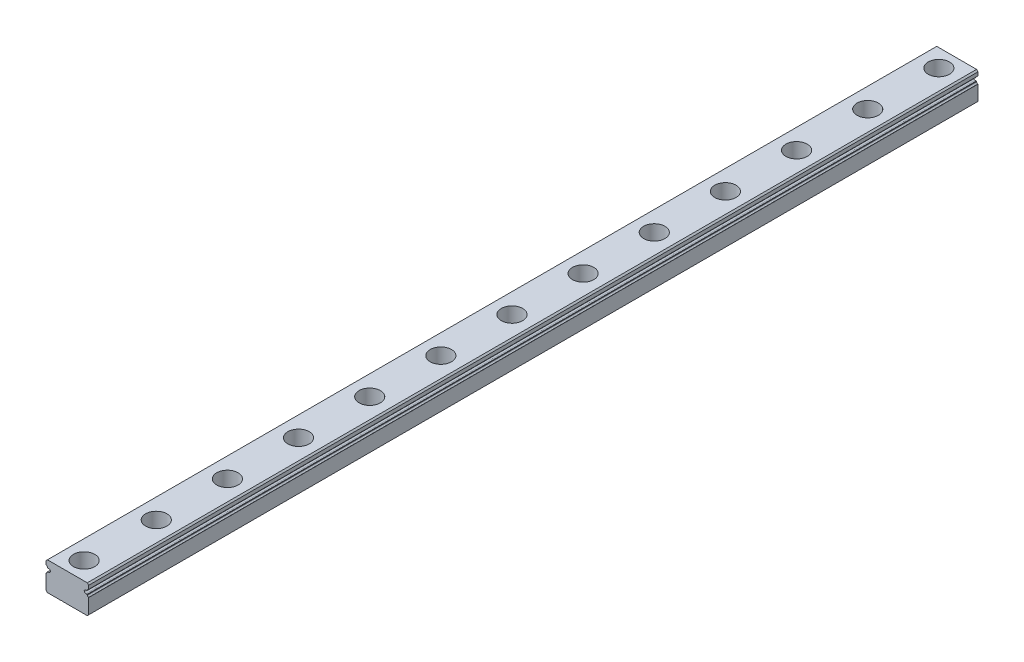
from build123d import *

# Parameters (mm, degrees)
CROQUIS1_W                                           = 12
CROQUIS1_H                                           = 250
SALIENTE_EXTRUIR1_DEPTH                              = 8
CORTAR_EXTRUIR1_DEPTH                                = 251.104793708
CORTAR_EXTRUIR2_DEPTH                                = 251.104793708
CORTAR_EXTRUIR3_DEPTH                                = 251.104793708
CORTAR_EXTRUIR4_DEPTH                                = 251.104793708
CORTAR_EXTRUIR5_DEPTH                                = 251.104793708
CORTAR_EXTRUIR6_DEPTH                                = 251.104793708
CORTAR_EXTRUIR7_DEPTH                                = 251.104793708
REFRENTADO_PARA_TORNILLO_CON_CABEZA_HEXA_D           = 3.5
REFRENTADO_PARA_TORNILLO_CON_CABEZA_HEXA_CBORE_D     = 6
REFRENTADO_PARA_TORNILLO_CON_CABEZA_HEXA_CBORE_DEPTH = 4.5
CHAFL_N1_SIZE                                        = 0.4
CHAFL_N2_SIZE                                        = 0.034056407
CHAFL_N2_SIZE_2                                      = 0.03688403
CHAFL_N3_SIZE                                        = 0.091173812
CHAFL_N3_SIZE_2                                      = 0.105000846


with BuildPart() as part:
    # Croquis1 → Saliente-Extruir1 (new body)
    with BuildSketch(Plane(origin=(0, 4.050658692, 0), x_dir=(1, 0, 0), z_dir=(0, 1, 0))):
        with Locations((0, 125)):
            Rectangle(CROQUIS1_W, CROQUIS1_H)
    extrude(amount=-SALIENTE_EXTRUIR1_DEPTH)

    # Croquis2 → Cortar-Extruir1 (cut, through all)
    with BuildSketch(Plane(origin=(0, 0, -250), x_dir=(-1, 0, 0), z_dir=(0, 0, -1))):
        with BuildLine():
            Line((1.35, -3.949341308), (1.85, -3.949341308))
            ThreePointArc((1.85, -3.949341308), (1.6, -3.849341308), (1.35, -3.949341308))
        make_face()
    extrude(amount=-CORTAR_EXTRUIR1_DEPTH, mode=Mode.SUBTRACT)

    # Croquis3 → Cortar-Extruir2 (cut, through all)
    with BuildSketch(Plane(origin=(0, 0, -250), x_dir=(-1, 0, 0), z_dir=(0, 0, -1))):
        with BuildLine():
            Line((-6, 2.100658692), (-6, 1.200658692))
            Line((-6, 1.200658692), (-5.2, 1.200658692))
            ThreePointArc((-5.2, 1.200658692), (-4.75, 1.650658692), (-5.2, 2.100658692))
            Line((-5.2, 2.100658692), (-6, 2.100658692))
        make_face()
    extrude(amount=-CORTAR_EXTRUIR2_DEPTH, mode=Mode.SUBTRACT)

    # Croquis4 → Cortar-Extruir3 (cut, through all)
    with BuildSketch(Plane(origin=(0, 0, -250), x_dir=(-1, 0, 0), z_dir=(0, 0, -1))):
        with BuildLine():
            Line((-5.622557264, 1.200658692), (-6, 1.200658692))
            Line((-6, 1.200658692), (-6, 0.689297919))
            ThreePointArc((-6, 0.689297919), (-5.684900038, 0.851696449), (-5.622557264, 1.200658692))
        make_face()
    extrude(amount=-CORTAR_EXTRUIR3_DEPTH, mode=Mode.SUBTRACT)

    # Croquis5 → Cortar-Extruir4 (cut, through all)
    with BuildSketch(Plane(origin=(0, 0, -250), x_dir=(-1, 0, 0), z_dir=(0, 0, -1))):
        with BuildLine():
            Line((-6, 2.612019466), (-6, 2.100658692))
            Line((-6, 2.100658692), (-5.622557264, 2.100658692))
            ThreePointArc((-5.622557264, 2.100658692), (-5.684900038, 2.449620935), (-6, 2.612019466))
        make_face()
    extrude(amount=-CORTAR_EXTRUIR4_DEPTH, mode=Mode.SUBTRACT)

    # Croquis6 → Cortar-Extruir5 (cut, through all)
    with BuildSketch(Plane(origin=(0, 0, -250), x_dir=(-1, 0, 0), z_dir=(0, 0, -1))):
        with BuildLine():
            Line((6, 1.200658692), (6, 2.100658692))
            Line((6, 2.100658692), (5.2, 2.100658692))
            ThreePointArc((5.2, 2.100658692), (4.75, 1.650658692), (5.2, 1.200658692))
            Line((5.2, 1.200658692), (6, 1.200658692))
        make_face()
    extrude(amount=-CORTAR_EXTRUIR5_DEPTH, mode=Mode.SUBTRACT)

    # Croquis7 → Cortar-Extruir6 (cut, through all)
    with BuildSketch(Plane(origin=(0, 0, -250), x_dir=(-1, 0, 0), z_dir=(0, 0, -1))):
        with BuildLine():
            Line((5.622557264, 2.100658692), (6, 2.100658692))
            Line((6, 2.100658692), (6, 2.612019466))
            ThreePointArc((6, 2.612019466), (5.684900038, 2.449620935), (5.622557264, 2.100658692))
        make_face()
    extrude(amount=-CORTAR_EXTRUIR6_DEPTH, mode=Mode.SUBTRACT)

    # Croquis8 → Cortar-Extruir7 (cut, through all)
    with BuildSketch(Plane(origin=(0, 0, -250), x_dir=(-1, 0, 0), z_dir=(0, 0, -1))):
        with BuildLine():
            Line((6, 0.689297919), (6, 1.200658692))
            Line((6, 1.200658692), (5.622557264, 1.200658692))
            ThreePointArc((5.622557264, 1.200658692), (5.684900038, 0.851696449), (6, 0.689297919))
        make_face()
    extrude(amount=-CORTAR_EXTRUIR7_DEPTH, mode=Mode.SUBTRACT)

    # Refrentado para tornillo con cabeza hexagonal de M31 (through all)
    with Locations(Plane(origin=(0, 4.050658692, 0), x_dir=(1, 0, 0), z_dir=(0, 1, 0))):
        with Locations((0, 45), (0, 65), (0, 85), (0, 105), (0, 125), (0, 145), (0, 165), (0, 185), (0, 205), (0, 225), (0, 245), (0, 25), (-0.275406539, 5)):
            CounterBoreHole(REFRENTADO_PARA_TORNILLO_CON_CABEZA_HEXA_D / 2, REFRENTADO_PARA_TORNILLO_CON_CABEZA_HEXA_CBORE_D / 2, REFRENTADO_PARA_TORNILLO_CON_CABEZA_HEXA_CBORE_DEPTH)

    # Chaflán1
    chafl_n1_edges = [part.edges().sort_by_distance(p)[0] for p in [
        (-6, -3.949341308, -125),
        (6, -3.949341308, -125),
        (-6, 4.050658692, -125),
        (6, 4.050658692, -125),
    ]]
    chamfer(chafl_n1_edges, length=CHAFL_N1_SIZE)

    # Chaflán2
    # the kernel refuses this chamfer: 0.03688403, 0.034056407 mm, written as the material it takes off along each edge
    with BuildSketch(Plane(origin=(6, 0.689297919, -250.100435582), x_dir=(-0.9978479381588691, 0.06557051404475742, 0), z_dir=(0, 0, 1))) as chafl_n2_piece_1:
        with BuildLine():
            Line((0.03902449, 0), (-CHAFL_N2_SIZE * 0.0655705141026, CHAFL_N2_SIZE * 0.997847939043))
            Line((-CHAFL_N2_SIZE * 0.0655705141026, CHAFL_N2_SIZE * 0.997847939043), (0, 0))
            ThreePointArc((0, 0), (0.020082989, 0.000475786), (0.03902449, 0))
        make_face()
    extrude(amount=250.200871164, mode=Mode.SUBTRACT)
    with BuildSketch(Plane(origin=(6, 2.612019466, -250.094971685), x_dir=(0, 1, 0), z_dir=(0, 0, 1))) as chafl_n2_piece_2:
        with BuildLine():
            Line((CHAFL_N2_SIZE_2 * 0.999999990825, 0), (-0.002179894, 0.035512658))
            ThreePointArc((-0.002179894, 0.035512658), (-0.000727719, 0.018309495), (0, 0))
            Line((0, 0), (CHAFL_N2_SIZE_2 * 0.999999990825, 0))
        make_face()
    extrude(amount=250.189943371, mode=Mode.SUBTRACT)
    with BuildSketch(Plane(origin=(-6, 2.612019466, -250.100435582), x_dir=(0, 1, 0), z_dir=(0, 0, 1))) as chafl_n2_piece_3:
        with BuildLine():
            Line((CHAFL_N2_SIZE, 0), (-0.002558856, -0.038940507))
            ThreePointArc((-0.002558856, -0.038940507), (-0.00084209, -0.020070966), (0, 0))
            Line((0, 0), (CHAFL_N2_SIZE, 0))
        make_face()
    extrude(amount=250.200871164, mode=Mode.SUBTRACT)
    with BuildSketch(Plane(origin=(-6, 0.689297919, -250.094971685), x_dir=(0.9981213351064977, 0.061268265890444186, 0), z_dir=(0, 0, 1))) as chafl_n2_piece_4:
        with BuildLine():
            Line((0.0355795, 0), (-CHAFL_N2_SIZE_2 * 0.0612682653277, -CHAFL_N2_SIZE_2 * 0.998121325949))
            Line((-CHAFL_N2_SIZE_2 * 0.0612682653277, -CHAFL_N2_SIZE_2 * 0.998121325949), (0, 0))
            ThreePointArc((0, 0), (0.018319684, -0.000395439), (0.0355795, 0))
        make_face()
    extrude(amount=250.189943371, mode=Mode.SUBTRACT)

    # Chaflán3
    # the kernel refuses this chamfer: 0.105000846, 0.091173812 mm, written as the material it takes off along each edge
    with BuildSketch(Plane(origin=(5.622557264, 1.200658692, -250.318147751), x_dir=(-0.1263625484615496, -0.991984126055605, 0), z_dir=(0, 0, 1)), Plane(origin=(-5.622557264, 2.100658692, -250.318147751), x_dir=(0.12636254846156672, 0.9919841260556028, 0), z_dir=(0, 0, 1))) as chafl_n3_piece_1:
        with BuildLine():
            Line((0.123959197, 0), (CHAFL_N3_SIZE * 0.126362548546, -CHAFL_N3_SIZE * 0.99198412672))
            Line((CHAFL_N3_SIZE * 0.126362548546, -CHAFL_N3_SIZE * 0.99198412672), (0, 0))
            ThreePointArc((0, 0), (0.063641461, -0.004827559), (0.123959197, 0))
        make_face()
    extrude(amount=250.636295502, mode=Mode.SUBTRACT)
    with BuildSketch(Plane(origin=(5.622557264, 2.100658692, -250.269677179), x_dir=(-1, 0, 0), z_dir=(0, 0, 1)), Plane(origin=(-5.622557264, 1.200658692, -250.269677179), x_dir=(1, 0, 0), z_dir=(0, 0, 1))) as chafl_n3_piece_2:
        with BuildLine():
            Line((CHAFL_N3_SIZE_2, 0), (0.015616157, -0.098323158))
            ThreePointArc((0.015616157, -0.098323158), (0.011085216, -0.04998658), (0, 0))
            Line((0, 0), (CHAFL_N3_SIZE_2, 0))
        make_face()
    extrude(amount=250.539354358, mode=Mode.SUBTRACT)


solid = part.part
